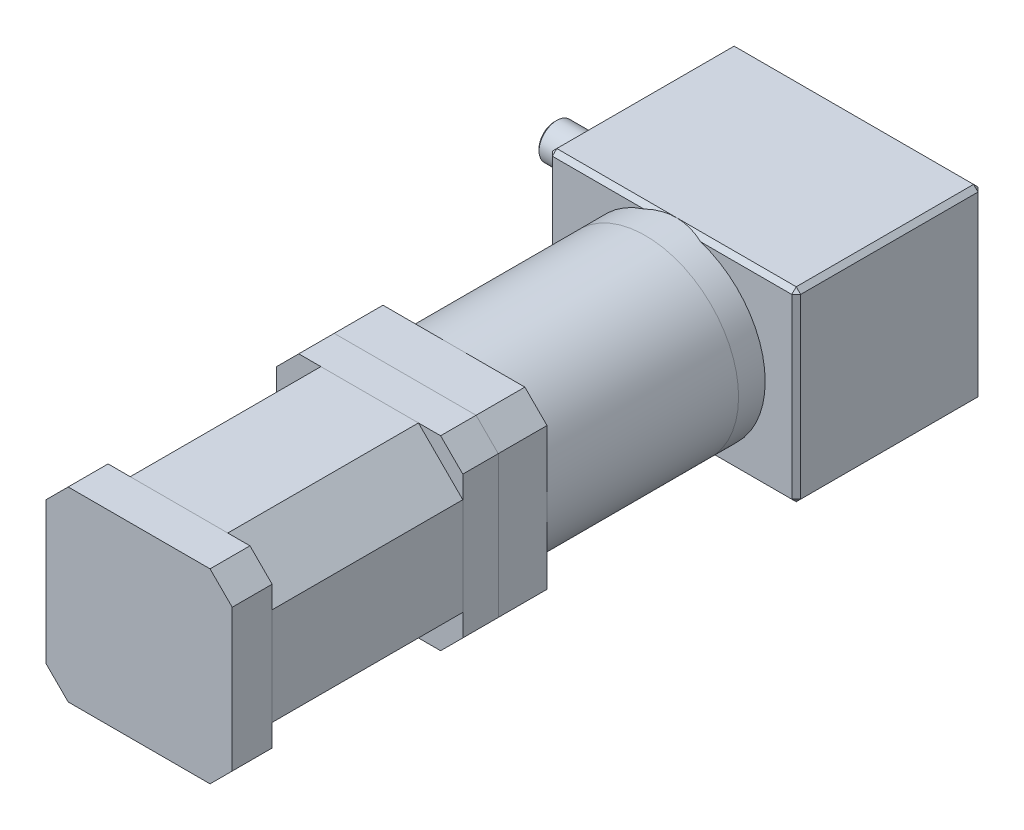
from build123d import *

# Parameters (mm, degrees)
SKETCH_1_W             = 42
SKETCH_1_H             = 42
EXTRUDE_1_DEPTH        = 60
CHAMFER_1_SIZE         = 5
CUT_EXTRUDE_1_DEPTH    = 43
EXTRUDE_2_DEPTH        = 11
SKETCH_4_R             = 21
EXTRUDE_3_DEPTH        = 49.2
SKETCH_5_W             = 56
SKETCH_5_H             = 42
EXTRUDE_4_DEPTH        = 42
CHAMFER_2_SIZE         = 1
HOLE_WIZARD_M4_1_D     = 3.3
HOLE_WIZARD_M4_1_DEPTH = 10.1
HOLE_WIZARD_M4_1_TIP   = 0.991420021
SKETCH_10_R            = 11
EXTRUDE_5_DEPTH        = 2
SKETCH_11_R            = 4
EXTRUDE_6_DEPTH        = 20
CHAMFER_3_SIZE         = 0.5
EXTRUDE_7_DEPTH        = 1.2
EXTRUDE_7_DEPTH_BACK   = 1


with BuildPart() as part:
    # 스케치1 → 보스-돌출1 (new body)
    with BuildSketch(Plane.XY):
        Rectangle(SKETCH_1_W, SKETCH_1_H)
    extrude(amount=EXTRUDE_1_DEPTH)

    # 모따기1
    chamfer_1_edges = [part.edges().sort_by_distance(p)[0] for p in [
        (21, 21, 30),
        (21, -21, 30),
        (-21, 21, 30),
        (-21, -21, 30),
        (-21, 21, 30),
        (-21, -21, 30),
        (21, 21, 30),
        (21, -21, 30),
        (21, -21, 30),
        (-21, -21, 30),
        (-21, 21, 30),
        (21, 21, 30),
    ]]
    chamfer(chamfer_1_edges, length=CHAMFER_1_SIZE)

    # 스케치2 → 컷-돌출1 (cut)
    with BuildSketch(Plane.XY.offset(51)):
        Polygon((-11, 21), (-21, 21), (-21, 11), align=None)
        Polygon((21, 11), (21, 21), (11, 21), align=None)
        Polygon((11, -21), (21, -21), (21, -11), align=None)
        Polygon((-21, -11), (-21, -21), (-11, -21), align=None)
    extrude(amount=-CUT_EXTRUDE_1_DEPTH, mode=Mode.SUBTRACT)

    # 스케치3 → 보스-돌출2 (add)
    with BuildSketch(Plane(origin=(0, 0, 0), x_dir=(-1, 0, 0), z_dir=(0, 0, -1))):
        Polygon((-16, 21), (-21, 16), (-21, -16), (-16, -21), (16, -21), (21, -16), (21, 16), (16, 21), align=None)
    extrude(amount=EXTRUDE_2_DEPTH)

    # 스케치4 → 보스-돌출3 (add)
    with BuildSketch(Plane(origin=(0, 0, -11), x_dir=(-1, 0, 0), z_dir=(0, 0, -1))):
        Circle(SKETCH_4_R)
    extrude(amount=EXTRUDE_3_DEPTH)

    # 스케치5 → 보스-돌출4 (add)
    with BuildSketch(Plane(origin=(0, 0, -60.2), x_dir=(-1, 0, 0), z_dir=(0, 0, -1))):
        Rectangle(SKETCH_5_W, SKETCH_5_H)
    extrude(amount=EXTRUDE_4_DEPTH)

    # 모따기2
    # the kernel refuses this chamfer: 1 mm, written as the material it takes off along each edge
    with BuildSketch(Plane(origin=(-27.333333333, 20.333333333, -60.866666667), x_dir=(0.7071067811865475, 0.7071067811865475, 0), z_dir=(-0.5773502691896258, 0.5773502691896258, 0.5773502691896258)), Plane(origin=(-27.333333333, -20.333333333, -60.866666667), x_dir=(-0.7071067811865475, 0.7071067811865475, 0), z_dir=(-0.5773502691896258, -0.5773502691896258, 0.5773502691896258)), Plane(origin=(27.333333333, 20.333333333, -60.866666667), x_dir=(0.7071067811865475, -0.7071067811865475, 0), z_dir=(0.5773502691896258, 0.5773502691896258, 0.5773502691896258)), Plane(origin=(27.333333333, -20.333333333, -101.533333333), x_dir=(0.7071067811865475, 0.7071067811865475, 0), z_dir=(0.5773502691896258, -0.5773502691896258, -0.5773502691896258))) as chamfer_2_piece_1:
        Polygon((-0.707106781, 0.40824829), (0.707106781, 0.40824829), (0, -0.816496581), align=None)
    extrude(amount=1.270170592, mode=Mode.SUBTRACT)
    with BuildSketch(Plane(origin=(-27.333333333, -20.333333333, -101.533333333), x_dir=(-0.7071067811865475, 0.7071067811865475, 0), z_dir=(-0.5773502691896258, -0.5773502691896258, -0.5773502691896258)), Plane(origin=(-27.333333333, 20.333333333, -101.533333333), x_dir=(0.7071067811865475, 0.7071067811865475, 0), z_dir=(-0.5773502691896258, 0.5773502691896258, -0.5773502691896258)), Plane(origin=(27.333333333, -20.333333333, -60.866666667), x_dir=(0.7071067811865475, 0.7071067811865475, 0), z_dir=(0.5773502691896258, -0.5773502691896258, 0.5773502691896258)), Plane(origin=(27.333333333, 20.333333333, -101.533333333), x_dir=(0.7071067811865475, -0.7071067811865475, 0), z_dir=(0.5773502691896258, 0.5773502691896258, -0.5773502691896258))) as chamfer_2_piece_2:
        Polygon((-0.707106781, -0.40824829), (0.707106781, -0.40824829), (0, 0.816496581), align=None)
    extrude(amount=1.270170592, mode=Mode.SUBTRACT)
    with BuildSketch(Plane(origin=(-28, 23.571682988, -60.2), x_dir=(0.9996219169112968, 0, 0.0274958766105891), z_dir=(0, -1, 0)), Plane(origin=(-28, -21, -57.628317012), x_dir=(0.9996219169112968, -0.027495876610585647, 0), z_dir=(0, 0, -1)), Plane(origin=(-28, 21, -57.628317012), x_dir=(-0.027495876610585647, -0.9996219169112968, 0), z_dir=(0, 0, -1)), Plane(origin=(28, -23.571682988, -60.2), x_dir=(-0.9996219169112968, 0, 0.0274958766105891), z_dir=(0, 1, 0)), Plane(origin=(28, 21, -57.628317012), x_dir=(-0.9996219169112968, 0.027495876610585647, 0), z_dir=(0, 0, -1)), Plane(origin=(-28, 23.571682988, -102.2), x_dir=(-0.02749587661058574, 0, 0.9996219169112968), z_dir=(0, -1, 0)), Plane(origin=(28, -23.571682988, -102.2), x_dir=(0.02749587661058574, 0, 0.9996219169112968), z_dir=(0, 1, 0))) as chamfer_2_piece_3:
        Polygon((CHAMFER_2_SIZE * 0.999621916911, -CHAMFER_2_SIZE * 0.0274958766106), (-CHAMFER_2_SIZE * 0.0274958766106, -CHAMFER_2_SIZE * 0.999621916911), (0, 0), align=None)
    extrude(amount=47.143365976, mode=Mode.SUBTRACT)
    with BuildSketch(Plane(origin=(0, 21, -60.2), x_dir=(0, -0.9996219169112968, 0.0274958766105891), z_dir=(-1, 0, 0))) as chamfer_2_piece_4_section:
        Polygon((CHAMFER_2_SIZE * 0.999621916911, -CHAMFER_2_SIZE * 0.0274958766106), (-CHAMFER_2_SIZE * 0.0274958766106, -CHAMFER_2_SIZE * 0.999621916911), (0, 0), align=None)
    chamfer_2_piece_4 = extrude(amount=30.571682988, mode=Mode.PRIVATE)
    chamfer_2_piece_4 = chamfer_2_piece_4 - Plane(origin=(0, 0, -60.539954397), x_dir=(-1, 0, 0), z_dir=(0, 0, 1)) * Cylinder(21, 66, mode=Mode.PRIVATE)
    add(chamfer_2_piece_4, mode=Mode.SUBTRACT)
    with BuildSketch(Plane(origin=(30.571682988, 21, -60.2), x_dir=(0, -0.9996219169112968, 0.0274958766105891), z_dir=(-1, 0, 0))) as chamfer_2_piece_5_section:
        Polygon((CHAMFER_2_SIZE * 0.999621916911, -CHAMFER_2_SIZE * 0.0274958766106), (-CHAMFER_2_SIZE * 0.0274958766106, -CHAMFER_2_SIZE * 0.999621916911), (0, 0), align=None)
    chamfer_2_piece_5 = extrude(amount=30.571682988, mode=Mode.PRIVATE)
    chamfer_2_piece_5 = chamfer_2_piece_5 - Plane(origin=(0, 0, -60.539954397), x_dir=(-1, 0, 0), z_dir=(0, 0, 1)) * Cylinder(21, 66, mode=Mode.PRIVATE)
    add(chamfer_2_piece_5, mode=Mode.SUBTRACT)
    with BuildSketch(Plane(origin=(4.1e-08, -21, -60.2), x_dir=(0, 0.9996219169112968, 0.0274958766105891), z_dir=(1, 0, 0))) as chamfer_2_piece_6_section:
        Polygon((CHAMFER_2_SIZE * 0.999621916911, -CHAMFER_2_SIZE * 0.0274958766106), (-CHAMFER_2_SIZE * 0.0274958766106, -CHAMFER_2_SIZE * 0.999621916911), (0, 0), align=None)
    chamfer_2_piece_6 = extrude(amount=30.571682947, mode=Mode.PRIVATE)
    chamfer_2_piece_6 = chamfer_2_piece_6 - Plane(origin=(0, 0, -60.539954397), x_dir=(-1, 0, 0), z_dir=(0, 0, 1)) * Cylinder(21, 66, mode=Mode.PRIVATE)
    add(chamfer_2_piece_6, mode=Mode.SUBTRACT)
    with BuildSketch(Plane(origin=(-30.571682988, -21, -60.2), x_dir=(0, 0.9996219169112968, 0.0274958766105891), z_dir=(1, 0, 0))) as chamfer_2_piece_7_section:
        Polygon((CHAMFER_2_SIZE * 0.999621916911, -CHAMFER_2_SIZE * 0.0274958766106), (-CHAMFER_2_SIZE * 0.0274958766106, -CHAMFER_2_SIZE * 0.999621916911), (0, 0), align=None)
    chamfer_2_piece_7 = extrude(amount=30.571683029, mode=Mode.PRIVATE)
    chamfer_2_piece_7 = chamfer_2_piece_7 - Plane(origin=(0, 0, -60.539954397), x_dir=(-1, 0, 0), z_dir=(0, 0, 1)) * Cylinder(21, 66, mode=Mode.PRIVATE)
    add(chamfer_2_piece_7, mode=Mode.SUBTRACT)
    with BuildSketch(Plane(origin=(28, -21, -57.628317012), x_dir=(-0.9996219169112968, -0.027495876610585647, 0), z_dir=(0, 0, -1))) as chamfer_2_piece_8:
        Polygon((CHAMFER_2_SIZE * 0.999621916911, CHAMFER_2_SIZE * 0.0274958766106), (-CHAMFER_2_SIZE * 0.0274958766106, CHAMFER_2_SIZE * 0.999621916911), (0, 0), align=None)
    extrude(amount=47.143365976, mode=Mode.SUBTRACT)
    with BuildSketch(Plane(origin=(30.571682988, 21, -102.2), x_dir=(0, 0.02749587661058574, 0.9996219169112968), z_dir=(-1, 0, 0)), Plane(origin=(-30.571682988, -21, -102.2), x_dir=(0, -0.02749587661058574, 0.9996219169112968), z_dir=(1, 0, 0))) as chamfer_2_piece_9:
        Polygon((CHAMFER_2_SIZE * 0.999621916911, -CHAMFER_2_SIZE * 0.0274958766106), (-CHAMFER_2_SIZE * 0.0274958766106, -CHAMFER_2_SIZE * 0.999621916911), (0, 0), align=None)
    extrude(amount=61.143365976, mode=Mode.SUBTRACT)

    # M4 나사 구멍1
    with Locations(Plane.ZY.offset(28)):
        with Locations((-96.074368671, 12.374368671), (-71.325631329, 12.374368671), (-71.325631329, -12.374368671), (-96.074368671, -12.374368671)):
            Hole(HOLE_WIZARD_M4_1_D / 2, depth=HOLE_WIZARD_M4_1_DEPTH)
            with Locations((0, 0, -(HOLE_WIZARD_M4_1_DEPTH + HOLE_WIZARD_M4_1_TIP / 2))):  # 118° drill point
                Cone(0, HOLE_WIZARD_M4_1_D / 2, HOLE_WIZARD_M4_1_TIP, mode=Mode.SUBTRACT)

    # 스케치10 → 보스-돌출5 (add)
    with BuildSketch(Plane.ZY.offset(28)):
        with Locations(Location((-83.7, 0, 0), (0, 0, 90))):
            Circle(SKETCH_10_R)
    extrude(amount=EXTRUDE_5_DEPTH)

    # 스케치11 → 보스-돌출6 (add)
    with BuildSketch(Plane.ZY.offset(30)):
        with Locations(Location((-83.7, 0, 0), (0, 0, 270))):
            Circle(SKETCH_11_R)
    extrude(amount=EXTRUDE_6_DEPTH)

    # 모따기3
    chamfer_3_edges = [part.edges().sort_by_distance(p)[0] for p in [
        (-50, 4, -83.7),
    ]]
    chamfer(chamfer_3_edges, length=CHAMFER_3_SIZE)

    # 스케치12 → 보스-돌출7 (add, two sides: drawn at the far end of the back side and taken through both)
    with BuildSketch(Plane(origin=(0, 0, -87.7), x_dir=(-1, 0, 0), z_dir=(0, 0, -1)).offset(-EXTRUDE_7_DEPTH_BACK)):
        with BuildLine():
            Line((37.5, 2), (44.5, 2))
            ThreePointArc((44.5, 2), (46.5, 0), (44.5, -2))
            Line((44.5, -2), (37.5, -2))
            ThreePointArc((37.5, -2), (35.5, 0), (37.5, 2))
        make_face()
    extrude(amount=EXTRUDE_7_DEPTH + EXTRUDE_7_DEPTH_BACK)


solid = part.part
